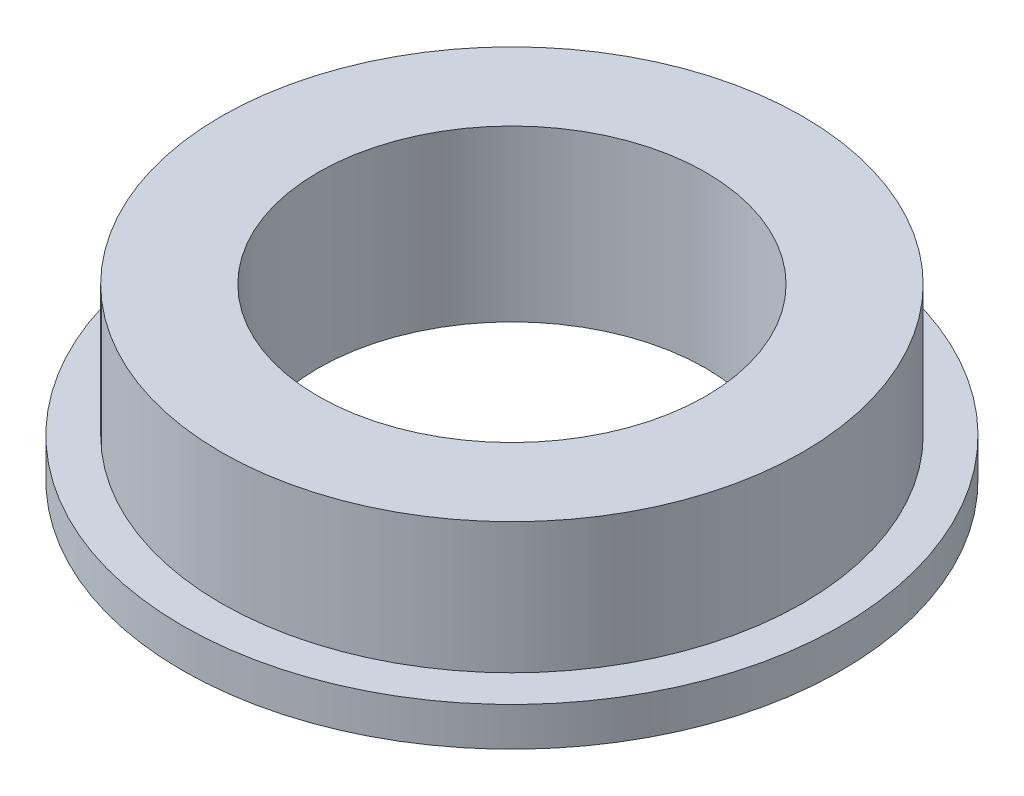
from build123d import *

# Parameters (mm, degrees)
SKETCH_1_R      = 6
SKETCH_1_R_2    = 4
EXTRUDE_1_DEPTH = 3.5
SKETCH_1_3_R    = 6.8
SKETCH_1_3_R_2  = 6
EXTRUDE_2_DEPTH = 0.8


with BuildPart() as part:
    # 草图1 → 凸台-拉伸1 (new body)
    with BuildSketch(Plane(origin=(0, 0, 0), x_dir=(1, 0, 0), z_dir=(0, 1, 0))):
        Circle(SKETCH_1_R)
        Circle(SKETCH_1_R_2, mode=Mode.SUBTRACT)
    extrude(amount=EXTRUDE_1_DEPTH)

    # 草图1<3> → 凸台-拉伸2 (add)
    with BuildSketch(Plane(origin=(0, 0, 0), x_dir=(1, 0, 0), z_dir=(0, 1, 0))):
        Circle(SKETCH_1_3_R)
        Circle(SKETCH_1_3_R_2, mode=Mode.SUBTRACT)
    extrude(amount=EXTRUDE_2_DEPTH)


solid = part.part
